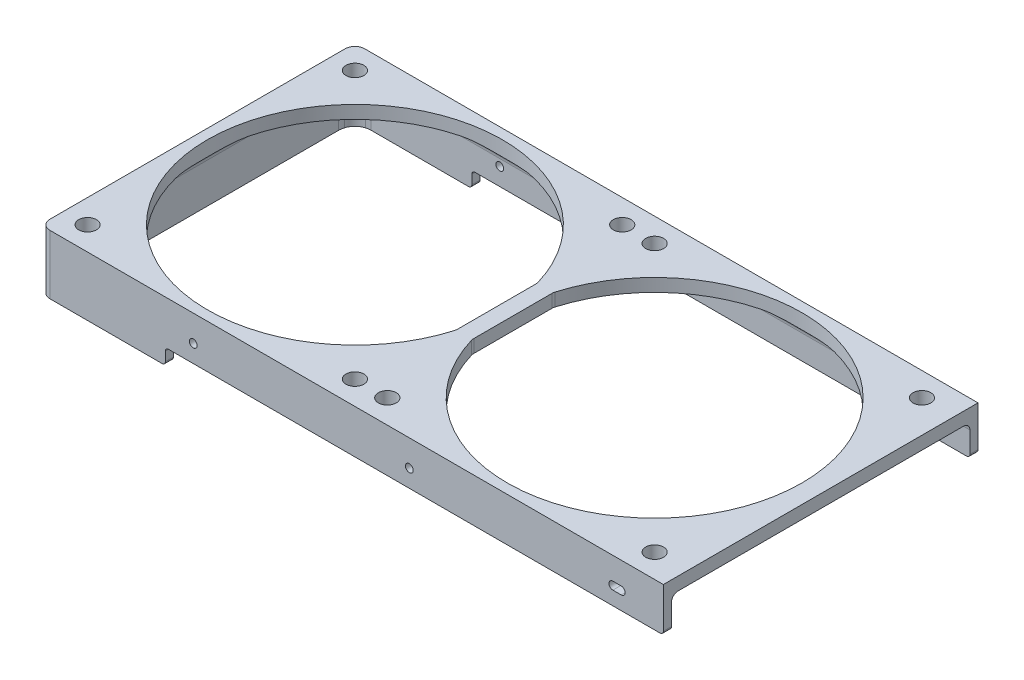
from build123d import *

# Parameters (mm, degrees)
SKETCH1_W                = 192.3
SKETCH1_H                = 97.1
BOSS_EXTRUDE1_DEPTH      = 13.5
SKETCH2_W                = 189.8
SKETCH2_H                = 92.1
CUT_EXTRUDE1_DEPTH       = 9.5
FILLET1_R                = 5
FILLET2_R                = 2
BOSS_EXTRUDE2_DEPTH      = 4.8
CUT_EXTRUDE2_DEPTH       = 109.657328331
CUT_EXTRUDE2_DEPTH_BACK  = 109.657328331
SKETCH4_R                = 2.75
FILLET4_R                = 3
CUT_EXTRUDE3_REACH       = 111.256
SKETCH5_R                = 4.75
FILLET5_R                = 1
M2_CLEARANCE_HOLE1_D     = 2.4
M2_START                 = 46.05
M2_CLEARANCE_SLOT1_DEPTH = 2.5
M2_START_2               = -48.55
M2_CLEARANCE_SLOT2_DEPTH = 2.5


# Read off the part's stored shape, not the designer's step: M2 Clearance Slot1, M2 Clearance Slot2
with BuildPart() as part:
    # Sketch1 → Boss-Extrude1 (new body)
    with BuildSketch(Plane(origin=(0, 0, 0), x_dir=(1, 0, 0), z_dir=(0, 1, 0))):
        Rectangle(SKETCH1_W, SKETCH1_H)
    extrude(amount=BOSS_EXTRUDE1_DEPTH)

    # Sketch2 → Cut-Extrude1 (cut)
    with BuildSketch(Plane.XZ):
        with Locations((1.25, 0)):
            Rectangle(SKETCH2_W, SKETCH2_H)
    extrude(amount=-CUT_EXTRUDE1_DEPTH, mode=Mode.SUBTRACT)

    # Fillet1
    fillet1_edges = [part.edges().sort_by_distance(p)[0] for p in [
        (-93.65, 4.75, 46.05),
        (-93.65, 4.75, -46.05),
    ]]
    fillet(fillet1_edges, radius=FILLET1_R)

    # Fillet2
    fillet2_edges = [part.edges().sort_by_distance(p)[0] for p in [
        (3.75, 9.5, 46.05),
        (3.75, 9.5, -46.05),
        (-93.65, 9.5, 0),
        (-92.185533906, 9.5, 44.585533906),
        (-92.185533906, 9.5, -44.585533906),
    ]]
    fillet(fillet2_edges, radius=FILLET2_R)

    # Sketch3 → Boss-Extrude2 (add)
    with BuildSketch(Plane.XZ):
        with BuildLine():
            Line((-57.55, 48.55), (-57.55, 46.05))
            Line((-57.55, 46.05), (-88.65, 46.05))
            ThreePointArc((-88.65, 46.05), (-92.185533906, 44.585533906), (-93.65, 41.05))
            Line((-93.65, 41.05), (-93.65, -41.05))
            ThreePointArc((-93.65, -41.05), (-92.185533906, -44.585533906), (-88.65, -46.05))
            Line((-88.65, -46.05), (-57.55, -46.05))
            Line((-57.55, -46.05), (-57.55, -48.55))
            Line((-57.55, -48.55), (-96.15, -48.55))
            Line((-96.15, -48.55), (-96.15, 48.55))
            Line((-96.15, 48.55), (-57.55, 48.55))
        make_face()
    extrude(amount=BOSS_EXTRUDE2_DEPTH)

    # Sketch4 → Cut-Extrude2 (cut, two sides: drawn at the far end of the back side and taken through both)
    with BuildSketch(Plane.XZ.offset(-9.5).offset(-CUT_EXTRUDE2_DEPTH_BACK)):
        with Locations(Location((-88.85, 41.25, 0), (0, 0, 270))):
            Circle(SKETCH4_R)
        with Locations(Location((-6.35, 41.25, 0), (0, 0, 270))):
            Circle(SKETCH4_R)
        with Locations(Location((-6.35, -41.25, 0), (0, 0, 270))):
            Circle(SKETCH4_R)
        with Locations(Location((-88.85, -41.25, 0), (0, 0, 270))):
            Circle(SKETCH4_R)
        with Locations(Location((86.15, -41.25, 0), (0, 0, 90))):
            Circle(SKETCH4_R)
        with Locations(Location((3.65, -41.25, 0), (0, 0, 90))):
            Circle(SKETCH4_R)
        with Locations(Location((3.65, 41.25, 0), (0, 0, 90))):
            Circle(SKETCH4_R)
        with Locations(Location((86.15, 41.25, 0), (0, 0, 90))):
            Circle(SKETCH4_R)
        with BuildLine():
            Line((-3.85, 12.49749975), (-3.85, -12.49749975))
            ThreePointArc((-3.85, -12.49749975), (-93.1, 0), (-3.85, 12.49749975))
        make_face()
        with BuildLine():
            Line((1.15, 12.49749975), (1.15, -12.49749975))
            ThreePointArc((1.15, -12.49749975), (90.4, 0), (1.15, 12.49749975))
        make_face()
    extrude(amount=CUT_EXTRUDE2_DEPTH + CUT_EXTRUDE2_DEPTH_BACK, mode=Mode.SUBTRACT)

    # Fillet4
    fillet4_edges = [part.edges().sort_by_distance(p)[0] for p in [
        (-3.85, 11.5, 12.49749975),
        (-3.85, 11.5, -12.49749975),
        (1.15, 11.5, -12.49749975),
        (1.15, 11.5, 12.49749975),
        (-96.15, 4.35, -48.55),
        (-96.15, 4.35, 48.55),
    ]]
    fillet(fillet4_edges, radius=FILLET4_R)

    # Cut-Extrude3: up to this face of the body (flat: up to its plane)
    cut_extrude3_end = Plane(part.part.faces().sort_by_distance((76.222532361, 9.5, -43.083044682))[0])
    # Sketch5 → Cut-Extrude3 (cut, up to the picked face)
    with BuildSketch(Plane.XZ.offset(4.8), mode=Mode.PRIVATE) as cut_extrude3_sk1:
        with Locations((-6.35, -41.25)):
            Circle(SKETCH5_R)
    cut_extrude3_tool1 = split(extrude(cut_extrude3_sk1.sketch, amount=-CUT_EXTRUDE3_REACH, mode=Mode.PRIVATE), bisect_by=cut_extrude3_end, keep=Keep.BOTH, mode=Mode.PRIVATE)
    # Sketch5 → Cut-Extrude3 (cut, up to the picked face)
    with BuildSketch(Plane.XZ.offset(4.8), mode=Mode.PRIVATE) as cut_extrude3_sk2:
        with Locations((3.65, -41.25)):
            Circle(SKETCH5_R)
    cut_extrude3_tool2 = split(extrude(cut_extrude3_sk2.sketch, amount=-CUT_EXTRUDE3_REACH, mode=Mode.PRIVATE), bisect_by=cut_extrude3_end, keep=Keep.BOTH, mode=Mode.PRIVATE)
    # Sketch5 → Cut-Extrude3 (cut, up to the picked face)
    with BuildSketch(Plane.XZ.offset(4.8), mode=Mode.PRIVATE) as cut_extrude3_sk3:
        with Locations((-88.85, -41.25)):
            Circle(SKETCH5_R)
    cut_extrude3_tool3 = split(extrude(cut_extrude3_sk3.sketch, amount=-CUT_EXTRUDE3_REACH, mode=Mode.PRIVATE), bisect_by=cut_extrude3_end, keep=Keep.BOTH, mode=Mode.PRIVATE)
    # Sketch5 → Cut-Extrude3 (cut, up to the picked face)
    with BuildSketch(Plane.XZ.offset(4.8), mode=Mode.PRIVATE) as cut_extrude3_sk4:
        with Locations((86.15, -41.25)):
            Circle(SKETCH5_R)
    cut_extrude3_tool4 = split(extrude(cut_extrude3_sk4.sketch, amount=-CUT_EXTRUDE3_REACH, mode=Mode.PRIVATE), bisect_by=cut_extrude3_end, keep=Keep.BOTH, mode=Mode.PRIVATE)
    # Sketch5 → Cut-Extrude3 (cut, up to the picked face)
    with BuildSketch(Plane.XZ.offset(4.8), mode=Mode.PRIVATE) as cut_extrude3_sk5:
        with Locations((86.15, 41.25)):
            Circle(SKETCH5_R)
    cut_extrude3_tool5 = split(extrude(cut_extrude3_sk5.sketch, amount=-CUT_EXTRUDE3_REACH, mode=Mode.PRIVATE), bisect_by=cut_extrude3_end, keep=Keep.BOTH, mode=Mode.PRIVATE)
    # Sketch5 → Cut-Extrude3 (cut, up to the picked face)
    with BuildSketch(Plane.XZ.offset(4.8), mode=Mode.PRIVATE) as cut_extrude3_sk6:
        with Locations((3.65, 41.25)):
            Circle(SKETCH5_R)
    cut_extrude3_tool6 = split(extrude(cut_extrude3_sk6.sketch, amount=-CUT_EXTRUDE3_REACH, mode=Mode.PRIVATE), bisect_by=cut_extrude3_end, keep=Keep.BOTH, mode=Mode.PRIVATE)
    # Sketch5 → Cut-Extrude3 (cut, up to the picked face)
    with BuildSketch(Plane.XZ.offset(4.8), mode=Mode.PRIVATE) as cut_extrude3_sk7:
        with Locations((-6.35, 41.25)):
            Circle(SKETCH5_R)
    cut_extrude3_tool7 = split(extrude(cut_extrude3_sk7.sketch, amount=-CUT_EXTRUDE3_REACH, mode=Mode.PRIVATE), bisect_by=cut_extrude3_end, keep=Keep.BOTH, mode=Mode.PRIVATE)
    # Sketch5 → Cut-Extrude3 (cut, up to the picked face)
    with BuildSketch(Plane.XZ.offset(4.8), mode=Mode.PRIVATE) as cut_extrude3_sk8:
        with Locations((-88.85, 41.25)):
            Circle(SKETCH5_R)
    cut_extrude3_tool8 = split(extrude(cut_extrude3_sk8.sketch, amount=-CUT_EXTRUDE3_REACH, mode=Mode.PRIVATE), bisect_by=cut_extrude3_end, keep=Keep.BOTH, mode=Mode.PRIVATE)
    add(cut_extrude3_tool1.solids().sort_by(Axis((-6.35, -4.8, -41.25), (0, 1, 0)))[0], mode=Mode.SUBTRACT)
    add(cut_extrude3_tool2.solids().sort_by(Axis((3.65, -4.8, -41.25), (0, 1, 0)))[0], mode=Mode.SUBTRACT)
    add(cut_extrude3_tool3.solids().sort_by(Axis((-88.85, -4.8, -41.25), (0, 1, 0)))[0], mode=Mode.SUBTRACT)
    add(cut_extrude3_tool4.solids().sort_by(Axis((86.15, -4.8, -41.25), (0, 1, 0)))[0], mode=Mode.SUBTRACT)
    add(cut_extrude3_tool5.solids().sort_by(Axis((86.15, -4.8, 41.25), (0, 1, 0)))[0], mode=Mode.SUBTRACT)
    add(cut_extrude3_tool6.solids().sort_by(Axis((3.65, -4.8, 41.25), (0, 1, 0)))[0], mode=Mode.SUBTRACT)
    add(cut_extrude3_tool7.solids().sort_by(Axis((-6.35, -4.8, 41.25), (0, 1, 0)))[0], mode=Mode.SUBTRACT)
    add(cut_extrude3_tool8.solids().sort_by(Axis((-88.85, -4.8, 41.25), (0, 1, 0)))[0], mode=Mode.SUBTRACT)

    # Fillet5
    fillet5_edges = [part.edges().sort_by_distance(p)[0] for p in [
        (96.15, 0, -47.3),
        (96.15, 0, 47.3),
        (-57.55, 0, -47.3),
        (-57.55, 0, 47.3),
        (-57.55, -4.8, -47.3),
        (-57.55, -4.8, 47.3),
    ]]
    fillet(fillet5_edges, radius=FILLET5_R)

    # M2 Clearance Hole1 (through all)
    with Locations(Plane.XY.offset(48.55)):
        with Locations((-48.95, 5.4), (17.75, 5.4)):
            Hole(M2_CLEARANCE_HOLE1_D / 2)

    # M2 Clearance Slot1 outline → M2 Clearance Slot1 (cut)
    with BuildSketch(Plane.XY.offset(M2_START)):
        with BuildLine():
            Line((80.55, 4.2), (83.15, 4.2))
            ThreePointArc((83.15, 4.2), (84.35, 5.4), (83.15, 6.6))
            Line((83.15, 6.6), (80.55, 6.6))
            ThreePointArc((80.55, 6.6), (79.35, 5.4), (80.55, 4.2))
        make_face()
    extrude(amount=M2_CLEARANCE_SLOT1_DEPTH, mode=Mode.SUBTRACT)

    # M2 Clearance Slot2 outline → M2 Clearance Slot2 (cut)
    with BuildSketch(Plane.XY.offset(M2_START_2)):
        with BuildLine():
            ThreePointArc((74.85, 6.591307994), (73.65, 5.391307994), (74.85, 4.191307994))
            Line((74.85, 4.191307994), (77.45, 4.191307994))
            ThreePointArc((77.45, 4.191307994), (78.65, 5.391307994), (77.45, 6.591307994))
            Line((77.45, 6.591307994), (74.85, 6.591307994))
        make_face()
    extrude(amount=M2_CLEARANCE_SLOT2_DEPTH, mode=Mode.SUBTRACT)


solid = part.part
